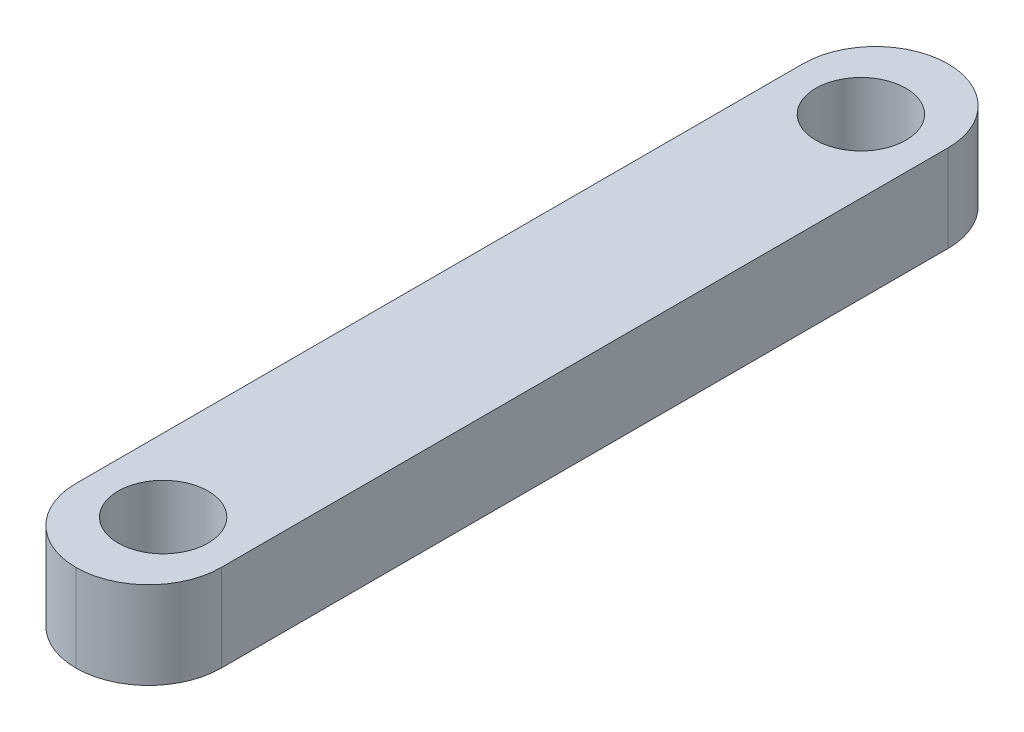
from build123d import *

# Parameters (mm, degrees)
SKETCH1_W           = 5
SKETCH1_H           = 30
SKETCH1_R           = 1.55
BOSS_EXTRUDE1_DEPTH = 3
FILLET1_R           = 2.5


with BuildPart() as part:
    # Sketch1 → Boss-Extrude1 (new body)
    with BuildSketch(Plane(origin=(0, 0, 0), x_dir=(1, 0, 0), z_dir=(0, 1, 0))):
        Rectangle(SKETCH1_W, SKETCH1_H)
        with Locations(Location((0, 12, 0), (0, 0, 270))):
            Circle(SKETCH1_R, mode=Mode.SUBTRACT)
        with Locations(Location((0, -12, 0), (0, 0, 270))):
            Circle(SKETCH1_R, mode=Mode.SUBTRACT)
    extrude(amount=BOSS_EXTRUDE1_DEPTH)

    # Fillet1
    fillet1_edges = [part.edges().sort_by_distance(p)[0] for p in [
        (-2.5, 1.5, 15),
        (-2.5, 1.5, -15),
        (2.5, 1.5, -15),
        (2.5, 1.5, 15),
    ]]
    fillet(fillet1_edges, radius=FILLET1_R - 0.0001)  # a hair under: the kernel refuses the full size


solid = part.part
